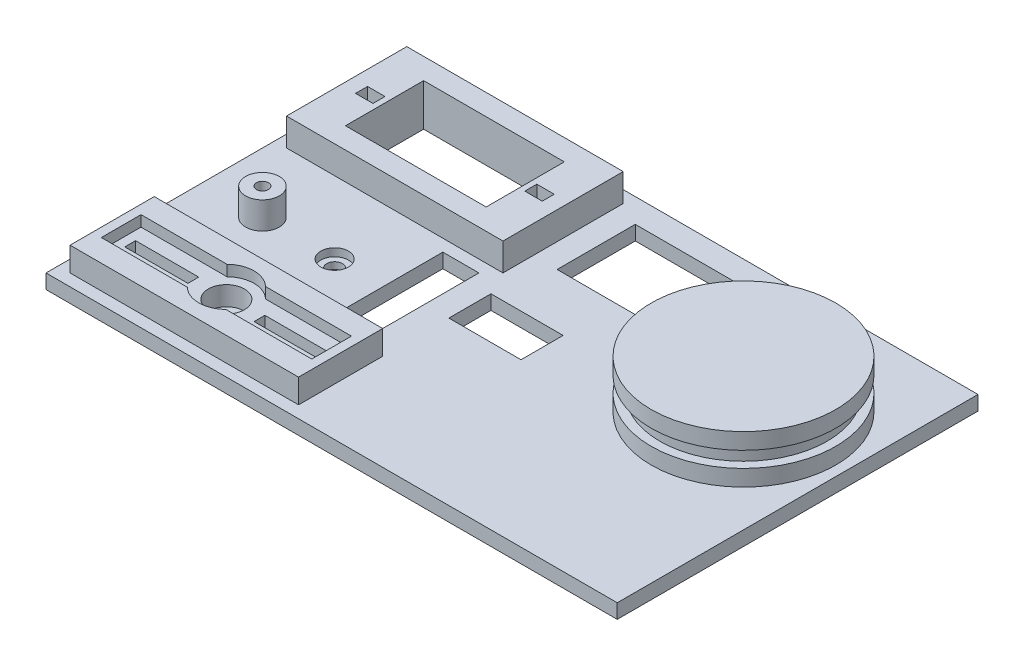
from build123d import *

# Parameters (mm, degrees)
SKETCH1_W            = 95
SKETCH1_H            = 2.4
BOSS_EXTRUDE1_DEPTH  = 60
BOSS_EXTRUDE2_START  = 2
SKETCH2_W            = 36
SKETCH2_H            = 4.6
BOSS_EXTRUDE2_DEPTH  = 20
BOSS_EXTRUDE3_START  = 5.5
SKETCH3_W            = 23.4
SKETCH3_H            = 9
BOSS_EXTRUDE3_DEPTH  = 13
BOSS_EXTRUDE4_START  = 11
SKETCH4_W            = 2.9
SKETCH4_H            = 9
BOSS_EXTRUDE4_DEPTH  = 2
BOSS_EXTRUDE5_START  = 11
SKETCH5_W            = 2.9
SKETCH5_H            = 9
BOSS_EXTRUDE5_DEPTH  = 2
BOSS_EXTRUDE6_START  = 4
SKETCH6_W            = 19.4
SKETCH6_H            = 4.4
BOSS_EXTRUDE6_DEPTH  = 13
BOSS_EXTRUDE7_START  = 2.4
SKETCH7_R            = 2.8
BOSS_EXTRUDE7_DEPTH  = 4.5
BOSS_EXTRUDE8_START  = 1.6
SKETCH8_R            = 1
BOSS_EXTRUDE8_DEPTH  = 6.3
BOSS_EXTRUDE9_START  = -1
SKETCH9_R            = 1.3
BOSS_EXTRUDE9_DEPTH  = 4.4
BOSS_EXTRUDE10_START = 1.1
SKETCH10_R           = 2.3
BOSS_EXTRUDE10_DEPTH = 2.3
BOSS_EXTRUDE11_START = 24
SKETCH11_W           = 6
SKETCH11_H           = 4.4
BOSS_EXTRUDE11_DEPTH = 17
BOSS_EXTRUDE12_START = 26
SKETCH12_W           = 12
SKETCH12_H           = 4.4
BOSS_EXTRUDE12_DEPTH = 7
BOSS_EXTRUDE13_START = 2.4
SKETCH13_R           = 15.35
BOSS_EXTRUDE13_DEPTH = 8
BOSS_EXTRUDE14_START = 5.1
SKETCH14_R           = 20
BOSS_EXTRUDE14_DEPTH = 2.6
BOSS_EXTRUDE15_START = 5.1
SKETCH15_R           = 13.9
BOSS_EXTRUDE15_DEPTH = 2.6
BOSS_EXTRUDE16_START = 44
SKETCH16_W           = 38
SKETCH16_H           = 4
BOSS_EXTRUDE16_DEPTH = 14
BOSS_EXTRUDE17_START = 4.6
SKETCH17_R           = 4.6
BOSS_EXTRUDE17_DEPTH = 2.3
BOSS_EXTRUDE18_START = 47.7
SKETCH18_W           = 17.5
SKETCH18_H           = 2.3
BOSS_EXTRUDE18_DEPTH = 6.6
BOSS_EXTRUDE19_START = 50.1
SKETCH19_W           = 10.5
SKETCH19_H           = 6
BOSS_EXTRUDE19_DEPTH = 1.8
BOSS_EXTRUDE20_START = 47.7
SKETCH20_W           = 17.5
SKETCH20_H           = 2.3
BOSS_EXTRUDE20_DEPTH = 6.6
BOSS_EXTRUDE21_START = 50.1
SKETCH21_W           = 10.5
SKETCH21_H           = 6
BOSS_EXTRUDE21_DEPTH = 1.8
BOSS_EXTRUDE22_START = 1.4
SKETCH22_R           = 3
BOSS_EXTRUDE22_DEPTH = 6


with BuildPart() as part:
    # Sketch1 → Boss-Extrude1 (new body)
    with BuildSketch(Plane.XY):
        with Locations((197.5, 1.2)):
            Rectangle(SKETCH1_W, SKETCH1_H)
    extrude(amount=BOSS_EXTRUDE1_DEPTH)

    # Sketch2 → Boss-Extrude2 (add)
    with BuildSketch(Plane.XY.offset(BOSS_EXTRUDE2_START)):
        with Locations((170, 4.7)):
            Rectangle(SKETCH2_W, SKETCH2_H)
    extrude(amount=BOSS_EXTRUDE2_DEPTH)


with BuildPart() as body_2:
    # Sketch3 → Boss-Extrude3 (new body)
    with BuildSketch(Plane.XY.offset(BOSS_EXTRUDE3_START)):
        with Locations((170, 3.5)):
            Rectangle(SKETCH3_W, SKETCH3_H)
    extrude(amount=BOSS_EXTRUDE3_DEPTH)


with BuildPart() as part_1:
    add(part.part)

    # Combine1: cut body 2
    add(body_2.part, mode=Mode.SUBTRACT)


with BuildPart() as body_2_2:
    # Sketch4 → Boss-Extrude4 (new body)
    with BuildSketch(Plane.XY.offset(BOSS_EXTRUDE4_START)):
        with Locations((155.925, 3.5)):
            Rectangle(SKETCH4_W, SKETCH4_H)
    extrude(amount=BOSS_EXTRUDE4_DEPTH)


with BuildPart() as part_2:
    add(part_1.part)

    # Combine2: cut body 2 2
    add(body_2_2.part, mode=Mode.SUBTRACT)


with BuildPart() as body_2_3:
    # Sketch5 → Boss-Extrude5 (new body)
    with BuildSketch(Plane.XY.offset(BOSS_EXTRUDE5_START)):
        with Locations((184.075, 3.5)):
            Rectangle(SKETCH5_W, SKETCH5_H)
    extrude(amount=BOSS_EXTRUDE5_DEPTH)


with BuildPart() as part_3:
    add(part_2.part)

    # Combine3: cut body 2 3
    add(body_2_3.part, mode=Mode.SUBTRACT)


with BuildPart() as body_2_4:
    # Sketch6 → Boss-Extrude6 (new body)
    with BuildSketch(Plane.XY.offset(BOSS_EXTRUDE6_START)):
        with Locations((201.7, 1.2)):
            Rectangle(SKETCH6_W, SKETCH6_H)
    extrude(amount=BOSS_EXTRUDE6_DEPTH)


with BuildPart() as part_4:
    add(part_3.part)

    # Combine4: cut body 2 4
    add(body_2_4.part, mode=Mode.SUBTRACT)

    # Sketch7 → Boss-Extrude7 (add)
    with BuildSketch(Plane(origin=(0, 0, 0), x_dir=(1, 0, 0), z_dir=(0, 1, 0)).offset(BOSS_EXTRUDE7_START)):
        with Locations((160, -34)):
            Circle(SKETCH7_R)
    extrude(amount=BOSS_EXTRUDE7_DEPTH)


with BuildPart() as body_2_5:
    # Sketch8 → Boss-Extrude8 (new body)
    with BuildSketch(Plane(origin=(0, 0, 0), x_dir=(1, 0, 0), z_dir=(0, 1, 0)).offset(BOSS_EXTRUDE8_START)):
        with Locations((160, -34)):
            Circle(SKETCH8_R)
    extrude(amount=BOSS_EXTRUDE8_DEPTH)


with BuildPart() as part_5:
    add(part_4.part)

    # Combine5: cut body 2 5
    add(body_2_5.part, mode=Mode.SUBTRACT)


with BuildPart() as body_2_6:
    # Sketch9 → Boss-Extrude9 (new body)
    with BuildSketch(Plane(origin=(0, 0, 0), x_dir=(1, 0, 0), z_dir=(0, 1, 0)).offset(BOSS_EXTRUDE9_START)):
        with Locations((172, -34)):
            Circle(SKETCH9_R)
    extrude(amount=BOSS_EXTRUDE9_DEPTH)


with BuildPart() as part_6:
    add(part_5.part)

    # Combine6: cut body 2 6
    add(body_2_6.part, mode=Mode.SUBTRACT)


with BuildPart() as body_2_7:
    # Sketch10 → Boss-Extrude10 (new body)
    with BuildSketch(Plane(origin=(0, 0, 0), x_dir=(1, 0, 0), z_dir=(0, 1, 0)).offset(BOSS_EXTRUDE10_START)):
        with Locations((172, -34)):
            Circle(SKETCH10_R)
    extrude(amount=BOSS_EXTRUDE10_DEPTH)


with BuildPart() as part_7:
    add(part_6.part)

    # Combine7: cut body 2 7
    add(body_2_7.part, mode=Mode.SUBTRACT)


with BuildPart() as body_2_8:
    # Sketch11 → Boss-Extrude11 (new body)
    with BuildSketch(Plane.XY.offset(BOSS_EXTRUDE11_START)):
        with Locations((183, 1.2)):
            Rectangle(SKETCH11_W, SKETCH11_H)
    extrude(amount=BOSS_EXTRUDE11_DEPTH)


with BuildPart() as part_8:
    add(part_7.part)

    # Combine8: cut body 2 8
    add(body_2_8.part, mode=Mode.SUBTRACT)


with BuildPart() as body_2_9:
    # Sketch12 → Boss-Extrude12 (new body)
    with BuildSketch(Plane.XY.offset(BOSS_EXTRUDE12_START)):
        with Locations((196, 1.2)):
            Rectangle(SKETCH12_W, SKETCH12_H)
    extrude(amount=BOSS_EXTRUDE12_DEPTH)


with BuildPart() as part_9:
    add(part_8.part)

    # Combine9: cut body 2 9
    add(body_2_9.part, mode=Mode.SUBTRACT)

    # Sketch13 → Boss-Extrude13 (add)
    with BuildSketch(Plane(origin=(0, 0, 0), x_dir=(1, 0, 0), z_dir=(0, 1, 0)).offset(BOSS_EXTRUDE13_START)):
        with Locations((228, -22)):
            Circle(SKETCH13_R)
    extrude(amount=BOSS_EXTRUDE13_DEPTH)


with BuildPart() as body_2_10:
    # Sketch14 → Boss-Extrude14 (new body)
    with BuildSketch(Plane(origin=(0, 0, 0), x_dir=(1, 0, 0), z_dir=(0, 1, 0)).offset(BOSS_EXTRUDE14_START)):
        with Locations((228, -22)):
            Circle(SKETCH14_R)
    extrude(amount=BOSS_EXTRUDE14_DEPTH)


with BuildPart() as part_10:
    add(part_9.part)

    # Combine10: cut body 2 10
    add(body_2_10.part, mode=Mode.SUBTRACT)

    # Sketch15 → Boss-Extrude15 (add)
    with BuildSketch(Plane(origin=(0, 0, 0), x_dir=(1, 0, 0), z_dir=(0, 1, 0)).offset(BOSS_EXTRUDE15_START)):
        with Locations((228, -22)):
            Circle(SKETCH15_R)
    extrude(amount=BOSS_EXTRUDE15_DEPTH)

    # Sketch16 → Boss-Extrude16 (add)
    with BuildSketch(Plane.XY.offset(BOSS_EXTRUDE16_START)):
        with Locations((171, 4.4)):
            Rectangle(SKETCH16_W, SKETCH16_H)
    extrude(amount=BOSS_EXTRUDE16_DEPTH)


with BuildPart() as body_2_11:
    # Sketch17 → Boss-Extrude17 (new body)
    with BuildSketch(Plane(origin=(0, 0, 0), x_dir=(1, 0, 0), z_dir=(0, 1, 0)).offset(BOSS_EXTRUDE17_START)):
        with Locations((171, -51)):
            Circle(SKETCH17_R)
    extrude(amount=BOSS_EXTRUDE17_DEPTH)


with BuildPart() as part_11:
    add(part_10.part)

    # Combine11: cut body 2 11
    add(body_2_11.part, mode=Mode.SUBTRACT)


with BuildPart() as body_2_12:
    # Sketch18 → Boss-Extrude18 (new body)
    with BuildSketch(Plane.XY.offset(BOSS_EXTRUDE18_START)):
        with Locations((179.75, 5.75)):
            Rectangle(SKETCH18_W, SKETCH18_H)
    extrude(amount=BOSS_EXTRUDE18_DEPTH)


with BuildPart() as part_12:
    add(part_11.part)

    # Combine12: cut body 2 12
    add(body_2_12.part, mode=Mode.SUBTRACT)


with BuildPart() as body_2_13:
    # Sketch19 → Boss-Extrude19 (new body)
    with BuildSketch(Plane.XY.offset(BOSS_EXTRUDE19_START)):
        with Locations((181.75, 4.4)):
            Rectangle(SKETCH19_W, SKETCH19_H)
    extrude(amount=BOSS_EXTRUDE19_DEPTH)


with BuildPart() as part_13:
    add(part_12.part)

    # Combine13: cut body 2 13
    add(body_2_13.part, mode=Mode.SUBTRACT)


with BuildPart() as body_2_14:
    # Sketch20 → Boss-Extrude20 (new body)
    with BuildSketch(Plane.XY.offset(BOSS_EXTRUDE20_START)):
        with Locations((162.25, 5.75)):
            Rectangle(SKETCH20_W, SKETCH20_H)
    extrude(amount=BOSS_EXTRUDE20_DEPTH)


with BuildPart() as part_14:
    add(part_13.part)

    # Combine14: cut body 2 14
    add(body_2_14.part, mode=Mode.SUBTRACT)


with BuildPart() as body_2_15:
    # Sketch21 → Boss-Extrude21 (new body)
    with BuildSketch(Plane.XY.offset(BOSS_EXTRUDE21_START)):
        with Locations((160.25, 4.4)):
            Rectangle(SKETCH21_W, SKETCH21_H)
    extrude(amount=BOSS_EXTRUDE21_DEPTH)


with BuildPart() as part_15:
    add(part_14.part)

    # Combine15: cut body 2 15
    add(body_2_15.part, mode=Mode.SUBTRACT)


with BuildPart() as body_2_16:
    # Sketch22 → Boss-Extrude22 (new body)
    with BuildSketch(Plane(origin=(0, 0, 0), x_dir=(1, 0, 0), z_dir=(0, 1, 0)).offset(BOSS_EXTRUDE22_START)):
        with Locations((171, -51)):
            Circle(SKETCH22_R)
    extrude(amount=BOSS_EXTRUDE22_DEPTH)


with BuildPart() as part_16:
    add(part_15.part)

    # Combine16: cut body 2 16
    add(body_2_16.part, mode=Mode.SUBTRACT)


solid = part_16.part
